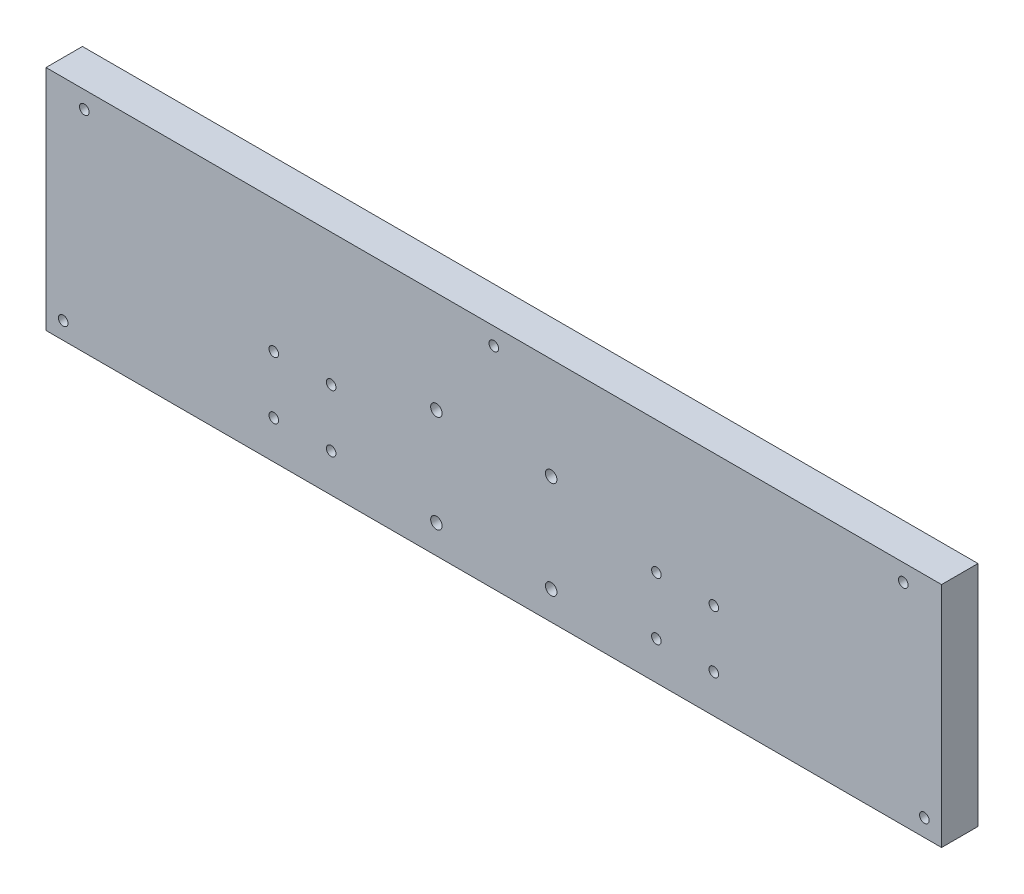
from build123d import *

# Parameters (mm, degrees)
SKETCH1_W                = 468.1
SKETCH1_H                = 119.05
BOSS_EXTRUDE1_DEPTH      = 19.05
M5_CLEARANCE_HOLE1_D     = 5
M5_CLEARANCE_HOLE1_DEPTH = 28.497848452
M5_CLEARANCE_HOLE1_TIP   = 1.502151548
M5_CLEARANCE_HOLE2_D     = 6
M5_CLEARANCE_HOLE2_DEPTH = 28.197418143
M5_CLEARANCE_HOLE2_TIP   = 1.802581857


with BuildPart() as part:
    # Sketch1 → Boss-Extrude1 (new body)
    with BuildSketch(Plane.XY):
        with Locations((0, 59.525)):
            Rectangle(SKETCH1_W, SKETCH1_H)
    extrude(amount=BOSS_EXTRUDE1_DEPTH)

    # M5 Clearance Hole1
    with Locations(Plane(origin=(0, 0, 0), x_dir=(-1, 0, 0), z_dir=(0, 0, -1))):
        with Locations((-115, 20), (-115, 50), (-85, 50), (-85, 20), (85, 20), (85, 50), (115, 50), (115, 20), (214.05, 110.05), (0, 110.05), (-214.05, 110.05), (-225.05, 9), (225.05, 9)):
            Hole(M5_CLEARANCE_HOLE1_D / 2, depth=M5_CLEARANCE_HOLE1_DEPTH)
            with Locations((0, 0, -(M5_CLEARANCE_HOLE1_DEPTH + M5_CLEARANCE_HOLE1_TIP / 2))):  # 118° drill point
                Cone(0, M5_CLEARANCE_HOLE1_D / 2, M5_CLEARANCE_HOLE1_TIP, mode=Mode.SUBTRACT)

    # M5 Clearance Hole2
    with Locations(Plane(origin=(0, 0, 0), x_dir=(-1, 0, 0), z_dir=(0, 0, -1))):
        with Locations((30, 15), (30, 66), (-30, 15), (-30, 66)):
            Hole(M5_CLEARANCE_HOLE2_D / 2, depth=M5_CLEARANCE_HOLE2_DEPTH)
            with Locations((0, 0, -(M5_CLEARANCE_HOLE2_DEPTH + M5_CLEARANCE_HOLE2_TIP / 2))):  # 118° drill point
                Cone(0, M5_CLEARANCE_HOLE2_D / 2, M5_CLEARANCE_HOLE2_TIP, mode=Mode.SUBTRACT)


solid = part.part
